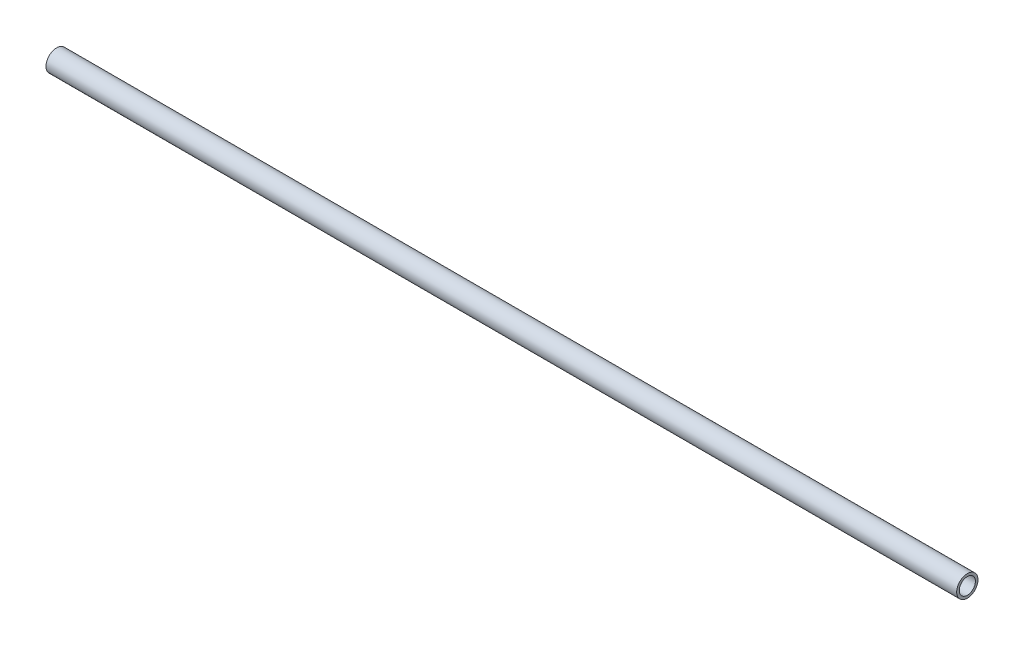
from build123d import *

# Parameters (mm, degrees)
SKETCH1_R           = 1.0541
SKETCH1_R_2         = 0.8001
BOSS_EXTRUDE1_DEPTH = 90
SKETCH3_R           = 0.79375
CUT_EXTRUDE2_DEPTH  = 10


with BuildPart() as part:
    # Sketch1 → Boss-Extrude1 (new body)
    with BuildSketch(Plane(origin=(0, 0, 0), x_dir=(0, 0, -1), z_dir=(1, 0, 0))):
        Circle(SKETCH1_R)
        Circle(SKETCH1_R_2, mode=Mode.SUBTRACT)
    extrude(amount=BOSS_EXTRUDE1_DEPTH)

    # Sketch3 → Cut-Extrude2 (cut)
    with BuildSketch(Plane.XY):
        with Locations((1.667374018, 0)):
            Circle(SKETCH3_R)
    extrude(amount=-CUT_EXTRUDE2_DEPTH, mode=Mode.SUBTRACT)


solid = part.part
